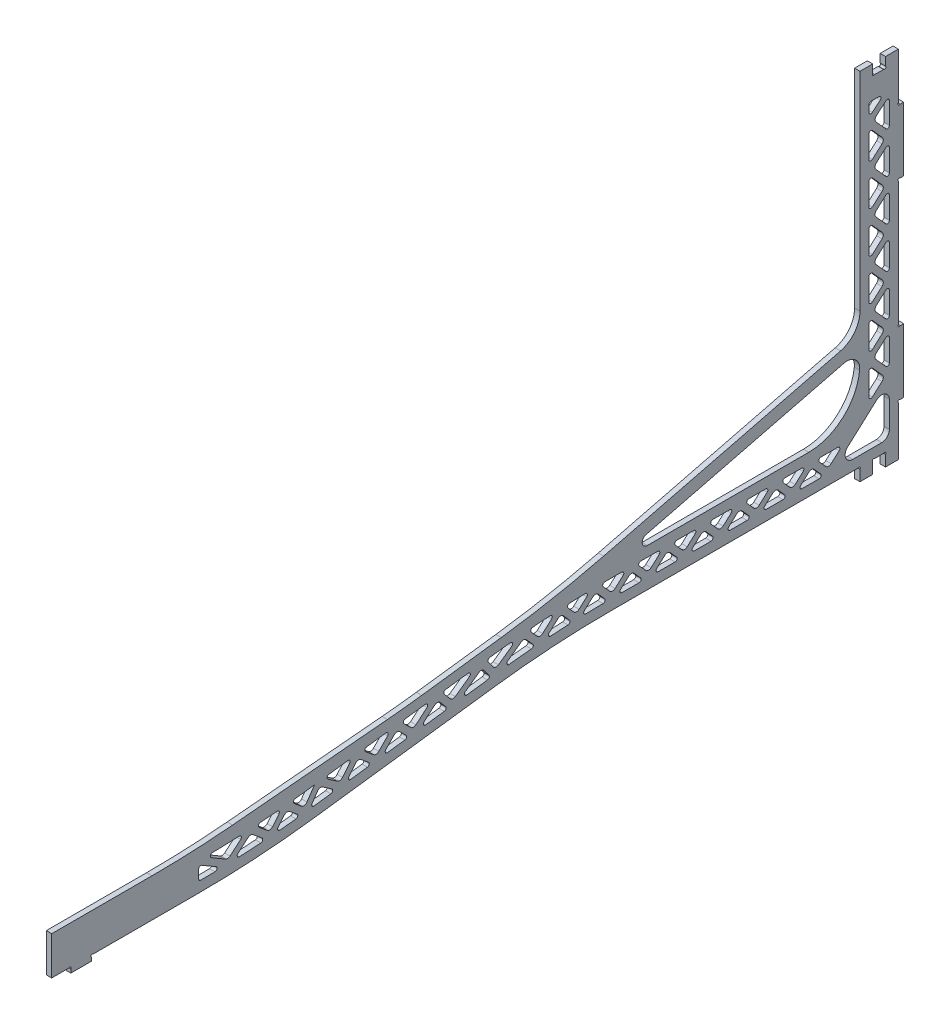
from build123d import *

# Parameters (mm, degrees)
SKETCH_2_W          = 5
SKETCH_2_H          = 4
SKETCH_2_H_2        = 5
EXTRUDE_1_DEPTH     = 1.05
SKETCH_3_W          = 2.1
SKETCH_3_H          = 25
EXTRUDE_2_DEPTH     = 2.1
FILLET_1_R          = 20
EXTRUDE_1_2_DEPTH   = 2.1
FILLET_2_R          = 10
FILLET_3_R          = 5
FILLET_4_R          = 2
FILLET_5_R          = 350
SKETCH_6_W          = 8
SKETCH_6_H          = 111.683841337
CUT_EXTRUDE_1_DEPTH = 10
CUT_EXTRUDE_2_DEPTH = 10
EXTRUDE_2_2_DEPTH   = 2.1
FILLET_6_R          = 3
FILLET_7_R          = 0.8
FILLET_8_R          = 1.5
FILLET_9_R          = 0.8
FILLET_10_R         = 1.5
CUT_EXTRUDE_3_DEPTH = 2.1
FILLET_11_R         = 0.3
SKETCH_10_W         = 8
SKETCH_10_H         = 2.1
EXTRUDE_3_DEPTH     = 2.1
SKETCH_11_R         = 0.5
CUT_EXTRUDE_4_DEPTH = 360.048771191
FILLET_12_R         = 0.3


with BuildPart() as part:
    # 草图2 → Extrude 1 (new, symmetric)
    with BuildSketch(Plane(origin=(0, 0, 0), x_dir=(0, 0, -1), z_dir=(1, 0, 0))):
        Polygon((55, 0), (0, 0), (0, -15), (80, -15), (196, 0), (80, 0), align=None)
        Polygon((138, 7.5), (80, 0), (196, 0), (316, 0), (321, 0), (326, 0), (331, 0), (331, 130), (326, 130), (321, 130), (316, 130), (316, 15), (196, 15), align=None)
        with Locations((328.5, 132)):
            Rectangle(SKETCH_2_W, SKETCH_2_H)
        with Locations((328.5, -2.5)):
            Rectangle(SKETCH_2_W, SKETCH_2_H_2)
        with Locations((318.5, -2.5)):
            Rectangle(SKETCH_2_W, SKETCH_2_H_2)
        Polygon((138, 7.5), (55, 0), (80, 0), align=None)
        with Locations((318.5, 132)):
            Rectangle(SKETCH_2_W, SKETCH_2_H)
    extrude(amount=EXTRUDE_1_DEPTH, both=True)

    # 草图3 → Extrude 2 (add)
    with BuildSketch(Plane(origin=(1.05, 0, 0), x_dir=(0, 0, -1), z_dir=(1, 0, 0))):
        with Locations((332.05, 102.5)):
            Rectangle(SKETCH_3_W, SKETCH_3_H)
        with Locations((332.05, 27.5)):
            Rectangle(SKETCH_3_W, SKETCH_3_H)
    extrude(amount=-EXTRUDE_2_DEPTH)

    # 圆角1
    fillet_1_edges = [part.edges().sort_by_distance(p)[0] for p in [
        (0, 15, -316),
    ]]
    fillet(fillet_1_edges, radius=FILLET_1_R)

    # 草图5 → Extrude 1 2 (add)
    with BuildSketch(Plane.ZY.offset(1.05)):
        Polygon((-316, 45), (-196, 15), (-197.212678125, 10.149287499), (-317.212678125, 40.149287499), align=None)
    extrude(amount=-EXTRUDE_1_2_DEPTH)

    # 圆角2
    fillet_2_edges = [part.edges().sort_by_distance(p)[0] for p in [
        (0, 45, -316),
    ]]
    fillet(fillet_2_edges, radius=FILLET_2_R)

    # 圆角3
    fillet_3_edges = [part.edges().sort_by_distance(p)[0] for p in [
        (0, 39.846117968, -316),
    ]]
    fillet(fillet_3_edges, radius=FILLET_3_R)

    # 圆角4
    fillet_4_edges = [part.edges().sort_by_distance(p)[0] for p in [
        (0, 15, -216.615528128),
    ]]
    fillet(fillet_4_edges, radius=FILLET_4_R)

    # 圆角5
    # the kernel refuses this fillet: 350 mm, written as the material it adds along each edge
    with BuildSketch(Plane(origin=(1.05, 15, -196), x_dir=(0, 0.24253562503633327, -0.9701425001453318), z_dir=(-1, 0, 0))) as fillet_5_piece_1:
        with BuildLine():
            CenterArc((FILLET_5_R * 0.0582567271498, -FILLET_5_R), FILLET_5_R, 90, 6.668192396)
            Line((-FILLET_5_R * 0.0578626358841, -FILLET_5_R * 0.00676473404908), (0, 0))
            Line((0, 0), (FILLET_5_R * 0.0582567271498, 0))
        make_face()
    extrude(amount=2.1)
    with BuildSketch(Plane(origin=(1.05, 0, -196), x_dir=(0, -0.12824260686651542, 0.9917428264343939), z_dir=(-1, 0, 0))) as fillet_5_piece_2:
        with BuildLine():
            CenterArc((FILLET_5_R * 0.0643871312925, -FILLET_5_R), FILLET_5_R, 90, 7.368051072)
            Line((-FILLET_5_R * 0.063855475574, -FILLET_5_R * 0.00825717356561), (0, 0))
            Line((0, 0), (FILLET_5_R * 0.0643871312925, 0))
        make_face()
    extrude(amount=2.1)
    with BuildSketch(Plane(origin=(1.05, 0, -55), x_dir=(0, 0.08999478045409695, -0.9959422370253301), z_dir=(-1, 0, 0))) as fillet_5_piece_3:
        with BuildLine():
            CenterArc((FILLET_5_R * 0.0450888702011, -FILLET_5_R), FILLET_5_R, 90, 5.163306814)
            Line((-FILLET_5_R * 0.044905910253, -FILLET_5_R * 0.00405776297467), (0, 0))
            Line((0, 0), (FILLET_5_R * 0.0450888702011, 0))
        make_face()
    extrude(amount=2.1)
    with BuildSketch(Plane(origin=(-1.05, 7.5, -138), x_dir=(0, 0.12824260686651465, -0.991742826434394), z_dir=(1, 0, 0))) as fillet_5_piece_4:
        with BuildLine():
            CenterArc((FILLET_5_R * 0.0192423976592, FILLET_5_R), FILLET_5_R, 267.795255743, 2.204744257)
            Line((-FILLET_5_R * 0.0192281531735, FILLET_5_R * 0.000740265637293), (0, 0))
            Line((0, 0), (FILLET_5_R * 0.0192423976592, 0))
        make_face()
    extrude(amount=2.1)
    # the kernel refuses this fillet: 350 mm, written as the material it takes off along each edge
    with BuildSketch(Plane(origin=(-57.388739881, -15, -80), x_dir=(0, 0, 1), z_dir=(1, 0, 0))) as fillet_5_2_piece_1:
        with BuildLine():
            CenterArc((FILLET_5_R * 0.0643871312925, -FILLET_5_R), FILLET_5_R, 90, 7.368051072)
            Line((-FILLET_5_R * 0.063855475574, -FILLET_5_R * 0.00825717356561), (0, 0))
            Line((0, 0), (FILLET_5_R * 0.0643871312925, 0))
        make_face()
    extrude(amount=114.777479762, mode=Mode.SUBTRACT)

    # 草图6 → 切除-拉伸1 (cut)
    with BuildSketch(Plane(origin=(1.05, 0, 0), x_dir=(0, 0, -1), z_dir=(1, 0, 0))):
        with Locations((323.5, 65.841920668)):
            Rectangle(SKETCH_6_W, SKETCH_6_H)
    extrude(amount=-CUT_EXTRUDE_1_DEPTH, mode=Mode.SUBTRACT)

    # 草图7 → 切除-拉伸2 (cut)
    with BuildSketch(Plane(origin=(1.05, 0, 0), x_dir=(0, 0, -1), z_dir=(1, 0, 0))):
        with BuildLine():
            Line((319.5, 20), (309.5, 11))
            Line((309.5, 11), (218.535495952, 11))
            ThreePointArc((218.535495952, 11), (195.339773111, 10.254019328), (172.239914874, 8.019160343))
            Line((172.239914874, 8.019160343), (100.938747775, -1.200818161))
            ThreePointArc((100.938747775, -1.200818161), (79.246637131, -3.299480754), (57.464504048, -4))
            Line((57.464504048, -4), (57.464504048, -11))
            ThreePointArc((57.464504048, -11), (79.69641569, -10.285015755), (101.836446023, -8.143017946))
            Line((101.836446023, -8.143017946), (173.137613122, 1.076960558))
            ThreePointArc((173.137613122, 1.076960558), (195.789551671, 3.268484327), (218.535495952, 4))
            Line((218.535495952, 4), (316, 4))
            Line((316, 4), (327.5, 4))
            Line((327.5, 4), (327.5, 10))
            Line((327.5, 10), (319.5, 10))
            Line((319.5, 10), (319.5, 20))
        make_face()
    extrude(amount=-CUT_EXTRUDE_2_DEPTH, mode=Mode.SUBTRACT)

    # 草图8 → Extrude 2 2 (add)
    with BuildSketch(Plane(origin=(1.05, 0, 0), x_dir=(0, 0, -1), z_dir=(1, 0, 0))):
        Polygon((56.830971449, -5.077560414), (69.174998853, -12.335013141), (77.745359711, -5.025292737), (85.730650552, -11.616970915), (91.892771273, -4.152054572), (99.373304454, -10.327066643), (104.770718871, -2.485193231), (113.317583217, -8.367839688), (119.773707919, -0.546761041), (127.085564604, -6.582534453), (134.970440798, 1.430282507), (141.235611396, -4.73485202), (150.910479815, 3.516910567), (156.264670666, -2.760668488), (168.253906877, 5.778892821), (172.844663523, -0.666364005), (184.675950313, 7.760694828), (190.633924069, 1.140723988), (199.047910617, 8.713311882), (204.878682549, 2.234676403), (212.656460327, 9.234676403), (218.956460327, 2.234676403), (226.734238105, 9.234676403), (233.034238105, 2.234676403), (240.812015882, 9.234676403), (247.112015882, 2.234676403), (254.88979366, 9.234676403), (261.18979366, 2.234676403), (268.967571438, 9.234676403), (275.267571438, 2.234676403), (283.045349216, 9.234676403), (289.345349216, 2.234676403), (297.123126994, 9.234676403), (303.423126994, 2.234676403), (329.265323597, 25.492653346), (321.265323597, 34.381542235), (329.265323597, 41.581542235), (321.265323597, 50.470431124), (329.265323597, 57.670431124), (321.265323597, 66.559320013), (329.265323597, 73.759320013), (321.265323597, 82.648208902), (329.265323597, 89.848208902), (321.265323597, 98.737097791), (329.265323597, 105.937097791), (321.291544589, 114.796852244), (328.307129629, 120.729356261), (326.692870371, 122.638326414), (317.708455411, 115.040944651), (325.734676403, 106.122921327), (317.734676403, 98.922921327), (325.734676403, 90.034032438), (317.734676403, 82.834032438), (325.734676403, 73.945143549), (317.734676403, 66.745143549), (325.734676403, 57.85625466), (317.734676403, 50.65625466), (325.734676403, 41.767365772), (317.734676403, 34.567365772), (325.734676403, 25.678476883), (303.60895053, 5.765323597), (297.30895053, 12.765323597), (289.531172752, 5.765323597), (283.231172752, 12.765323597), (275.453394975, 5.765323597), (269.153394975, 12.765323597), (261.375617197, 5.765323597), (255.075617197, 12.765323597), (247.297839419, 5.765323597), (240.997839419, 12.765323597), (233.220061641, 5.765323597), (226.920061641, 12.765323597), (219.142283863, 5.765323597), (212.842283863, 12.765323597), (205.064506086, 5.765323597), (199.233734154, 12.243959077), (190.819747605, 4.671371183), (185.042185799, 11.090884302), (173.43056272, 2.820285121), (168.839806074, 9.265541947), (156.680197195, 0.604629468), (151.190267994, 7.04135642), (141.356251678, -1.346144516), (134.941988602, 4.965701927), (126.910400493, -3.196207511), (119.437231888, 2.972725268), (112.847947819, -5.0096653), (104.128779789, 0.991574552), (98.860787351, -6.662262385), (91.556295241, -0.632568263), (85.39417452, -8.097484606), (77.719096561, -1.761880192), (68.9072777, -9.277541806), (58.098036647, -2.922439586), align=None)
    extrude(amount=-EXTRUDE_2_2_DEPTH)

    # 圆角6
    fillet_6_edges = [part.edges().sort_by_distance(p)[0] for p in [
        (0, 4, -327.5),
        (0, 4, -305.384597657),
        (0, 23.903862108, -327.5),
    ]]
    fillet(fillet_6_edges, radius=FILLET_6_R)

    # 圆角7
    fillet_7_edges = [part.edges().sort_by_distance(p)[0] for p in [
        (0, 121.683841337, -319.5),
        (0, 121.683841337, -325.564127566),
        (0, 120.04683303, -327.5),
        (0, 107.898568454, -327.5),
        (0, 104.348306553, -327.5),
        (0, 91.809679565, -327.5),
        (0, 88.259417664, -327.5),
        (0, 75.720790676, -327.5),
        (0, 72.170528775, -327.5),
        (0, 59.631901788, -327.5),
        (0, 56.081639886, -327.5),
        (0, 43.543012899, -327.5),
        (0, 39.992750997, -327.5),
        (0, 27.45412401, -327.5),
        (0, 32.605895108, -319.5),
        (0, 36.156157009, -319.5),
        (0, 48.694783997, -319.5),
        (0, 52.245045898, -319.5),
        (0, 64.783672886, -319.5),
        (0, 68.333934787, -319.5),
        (0, 80.872561774, -319.5),
        (0, 84.422823676, -319.5),
        (0, 96.961450663, -319.5),
        (0, 100.511712565, -319.5),
        (0, 113.050339552, -319.5),
        (0, 116.555906755, -319.5),
        (0, 20.06726812, -319.5),
    ]]
    fillet(fillet_7_edges, radius=FILLET_7_R)

    # 圆角8
    fillet_8_edges = [part.edges().sort_by_distance(p)[0] for p in [
        (0, 106.122921327, -325.734676403),
        (0, 90.034032438, -325.734676403),
        (0, 73.945143549, -325.734676403),
        (0, 57.85625466, -325.734676403),
        (0, 41.767365772, -325.734676403),
        (0, 25.678476883, -325.734676403),
        (0, 34.381542235, -321.265323597),
        (0, 50.470431124, -321.265323597),
        (0, 66.559320013, -321.265323597),
        (0, 82.648208902, -321.265323597),
        (0, 98.737097791, -321.265323597),
        (0, 114.796852244, -321.291544589),
    ]]
    fillet(fillet_8_edges, radius=FILLET_8_R)

    # 圆角9
    fillet_9_edges = [part.edges().sort_by_distance(p)[0] for p in [
        (0, 4, -263.151264324),
        (0, 4, -277.229042102),
        (0, 4, -291.306819879),
        (0, 4, -249.073486546),
        (0, 4, -234.995708768),
        (0, 4, -220.917930991),
        (0, 3.799312371, -206.617166958),
        (0, 1.405284076, -175.753182742),
        (0, 3.060913643, -192.767468129),
        (0, -0.737604043, -159.104980213),
        (0, -2.746902673, -143.56640414),
        (0, -4.629535048, -129.007380439),
        (0, -6.454111457, -114.897322875),
        (0, -9.71089339, -87.304074723),
        (0, -10.733056747, -71.053229977),
        (0, -10.876857545, -66.694856948),
        (0, -9.998573964, -83.770092102),
        (0, -6.928755117, -111.22674524),
        (0, -5.108890736, -125.300363118),
        (0, -3.244184711, -139.720756375),
        (0, -1.269361265, -154.99272436),
        (0, 0.895248753, -171.732375163),
        (0, 2.77903506, -189.159444104),
        (0, 3.683714693, -203.574548088),
        (0, 4, -231.445446867),
        (0, 4, -245.523224645),
        (0, 4, -259.601002423),
        (0, 4, -273.6787802),
        (0, 4, -287.756557978),
        (0, 4, -301.834335756),
        (0, 11, -284.81996399),
        (0, 11, -298.897741768),
        (0, 11, -270.742186212),
        (0, 11, -256.664408434),
        (0, 11, -242.586630657),
        (0, 11, -228.508852879),
        (0, 10.976902229, -214.451863095),
        (0, 10.561510398, -200.747937965),
        (0, 9.567980183, -186.412799505),
        (0, 7.721686022, -169.939446792),
        (0, 5.470475248, -152.530083475),
        (0, 3.40167866, -136.531389862),
        (0, 1.432501868, -121.303089334),
        (0, -0.506806717, -106.305769608),
        (0, -2.097334528, -93.330742404),
        (0, -3.279330496, -79.557366223),
        (0, -3.991137564, -59.915759424),
        (0, -3.510880012, -75.668462778),
        (0, -2.427922885, -90.074270339),
        (0, 0.978341076, -117.790912546),
        (0, 2.938156283, -132.94681681),
        (0, 4.985537898, -148.779901302),
        (0, 7.20549577, -165.947575509),
        (0, 9.183268111, -182.363961441),
        (0, 10.365826377, -197.146920043),
        (0, 10.916864571, -210.788440501),
        (0, 11, -224.958590978),
        (0, 11, -239.036368755),
        (0, 11, -253.114146533),
        (0, 11, -267.191924311),
        (0, 11, -281.269702089),
        (0, 11, -295.347479866),
        (0, 11, -309.425257644),
        (0, 3.998079394, -217.369397635),
        (0, -8.68888837, -97.388782515),
        (0, -8.27746931, -100.784003864),
        (0, -11, -57.464504048),
        (0, -5.450034708, -57.464504048),
    ]]
    fillet(fillet_9_edges, radius=FILLET_9_R)

    # 圆角10
    fillet_10_edges = [part.edges().sort_by_distance(p)[0] for p in [
        (0, -5.025292737, -77.745359711),
        (0, -4.152054572, -91.892771273),
        (0, -2.485193231, -104.770718871),
        (0, 0.604629468, -156.680197195),
        (0, -1.346144516, -141.356251678),
        (0, -3.196207511, -126.910400493),
        (0, -5.0096653, -112.847947819),
        (0, -6.662262385, -98.860787351),
        (0, 5.765323597, -205.064506086),
        (0, 4.671371183, -190.819747605),
        (0, 2.820285121, -173.43056272),
        (0, 5.765323597, -303.60895053),
        (0, 5.765323597, -289.531172752),
        (0, 5.765323597, -275.453394975),
        (0, 5.765323597, -261.375617197),
        (0, 5.765323597, -247.297839419),
        (0, 5.765323597, -233.220061641),
        (0, 5.765323597, -219.142283863),
        (0, -0.546761041, -119.773707919),
        (0, 1.430282507, -134.970440798),
        (0, 3.516910567, -150.910479815),
        (0, 5.778892821, -168.253906877),
        (0, 7.760694828, -184.675950313),
        (0, 8.713311882, -199.047910617),
        (0, 9.234676403, -212.656460327),
        (0, 9.234676403, -226.734238105),
        (0, 9.234676403, -240.812015882),
        (0, 9.234676403, -254.88979366),
        (0, 9.234676403, -268.967571438),
        (0, 9.234676403, -283.045349216),
        (0, 9.234676403, -297.123126994),
        (0, -8.097484606, -85.39417452),
        (0, -9.277541806, -68.9072777),
    ]]
    fillet(fillet_10_edges, radius=FILLET_10_R)

    # 草图9 → 切除-拉伸3 (cut)
    with BuildSketch(Plane(origin=(1.05, 0, 0), x_dir=(0, 0, -1), z_dir=(1, 0, 0))):
        with BuildLine():
            ThreePointArc((326.146446609, 130.353553391), (326.108386376, 130.544895107), (326, 130.707106781))
            Line((326, 130.707106781), (325.646446609, 130.353553391))
            Line((325.646446609, 130.353553391), (326, 130))
            ThreePointArc((326, 130), (326.108386376, 130.162211674), (326.146446609, 130.353553391))
        make_face()
        with BuildLine():
            Line((326, 130), (325.646446609, 130.353553391))
            Line((325.646446609, 130.353553391), (325.292893219, 130))
            ThreePointArc((325.292893219, 130), (325.646446609, 129.853553391), (326, 130))
        make_face()
        with BuildLine():
            Line((331.353553391, 115.353553391), (331, 115.707106781))
            ThreePointArc((331, 115.707106781), (330.853553391, 115.353553391), (331, 115))
            Line((331, 115), (331.353553391, 115.353553391))
        make_face()
        with BuildLine():
            Line((331.707106781, 115), (331.353553391, 115.353553391))
            Line((331.353553391, 115.353553391), (331, 115))
            ThreePointArc((331, 115), (331.353553391, 114.853553391), (331.707106781, 115))
        make_face()
        with BuildLine():
            Line((331.353553391, 89.646446609), (331.707106781, 90))
            ThreePointArc((331.707106781, 90), (331.353553391, 90.146446609), (331, 90))
            Line((331, 90), (331.353553391, 89.646446609))
        make_face()
        with BuildLine():
            Line((331, 89.292893219), (331.353553391, 89.646446609))
            Line((331.353553391, 89.646446609), (331, 90))
            ThreePointArc((331, 90), (330.853553391, 89.646446609), (331, 89.292893219))
        make_face()
        with BuildLine():
            ThreePointArc((331, 40), (331.353553391, 39.853553391), (331.707106781, 40))
            Line((331.707106781, 40), (331.353553391, 40.353553391))
            Line((331.353553391, 40.353553391), (331, 40))
        make_face()
        with BuildLine():
            Line((331, 40), (331.353553391, 40.353553391))
            Line((331.353553391, 40.353553391), (331, 40.707106781))
            ThreePointArc((331, 40.707106781), (330.853553391, 40.353553391), (331, 40))
        make_face()
        with BuildLine():
            Line((331.353553391, 14.646446609), (331.707106781, 15))
            ThreePointArc((331.707106781, 15), (331.353553391, 15.146446609), (331, 15))
            Line((331, 15), (331.353553391, 14.646446609))
        make_face()
        with BuildLine():
            Line((331, 14.292893219), (331.353553391, 14.646446609))
            Line((331.353553391, 14.646446609), (331, 15))
            ThreePointArc((331, 15), (330.853553391, 14.646446609), (331, 14.292893219))
        make_face()
        with BuildLine():
            Line((325.646446609, -0.353553391), (326, -0.707106781))
            ThreePointArc((326, -0.707106781), (326.108386376, -0.544895107), (326.146446609, -0.353553391))
            ThreePointArc((326.146446609, -0.353553391), (326.108386376, -0.162211674), (326, 0))
            Line((326, 0), (325.646446609, -0.353553391))
        make_face()
        with BuildLine():
            Line((325.292893219, 0), (325.646446609, -0.353553391))
            Line((325.646446609, -0.353553391), (326, 0))
            ThreePointArc((326, 0), (325.646446609, 0.146446609), (325.292893219, 0))
        make_face()
        with BuildLine():
            Line((321.353553391, -0.353553391), (321.707106781, 0))
            ThreePointArc((321.707106781, 0), (321.353553391, 0.146446609), (321, 0))
            Line((321, 0), (321.353553391, -0.353553391))
        make_face()
        with BuildLine():
            Line((321, -0.707106781), (321.353553391, -0.353553391))
            Line((321.353553391, -0.353553391), (321, 0))
            ThreePointArc((321, 0), (320.853553391, -0.353553391), (321, -0.707106781))
        make_face()
        with BuildLine():
            Line((315.646446609, -0.353553391), (316, -0.707106781))
            ThreePointArc((316, -0.707106781), (316.108386376, -0.544895107), (316.146446609, -0.353553391))
            ThreePointArc((316.146446609, -0.353553391), (316.108386376, -0.162211674), (316, 0))
            Line((316, 0), (315.646446609, -0.353553391))
        make_face()
        with BuildLine():
            Line((315.292893219, 0), (315.646446609, -0.353553391))
            Line((315.646446609, -0.353553391), (316, 0))
            ThreePointArc((316, 0), (315.646446609, 0.146446609), (315.292893219, 0))
        make_face()
        with BuildLine():
            ThreePointArc((321, 130), (321.353553391, 129.853553391), (321.707106781, 130))
            Line((321.707106781, 130), (321.353553391, 130.353553391))
            Line((321.353553391, 130.353553391), (321, 130))
        make_face()
        with BuildLine():
            Line((321, 130), (321.353553391, 130.353553391))
            Line((321.353553391, 130.353553391), (321, 130.707106781))
            ThreePointArc((321, 130.707106781), (320.853553391, 130.353553391), (321, 130))
        make_face()
    extrude(amount=-CUT_EXTRUDE_3_DEPTH, mode=Mode.SUBTRACT)

    # 圆角11
    fillet_11_edges = [part.edges().sort_by_distance(p)[0] for p in [
        (0, 0, -325.292893219),
        (0, -0.707106781, -326),
        (0, 0, -321.707106781),
        (0, -0.707106781, -321),
        (0, 0, -315.292893219),
        (0, -0.707106781, -316),
        (0, 130, -321.707106781),
        (0, 130.707106781, -321),
        (0, 15, -331.707106781),
        (0, 14.292893219, -331),
        (0, 40, -331.707106781),
        (0, 40.707106781, -331),
        (0, 90, -331.707106781),
        (0, 89.292893219, -331),
        (0, 115, -331.707106781),
        (0, 115.707106781, -331),
        (0, 130, -325.292893219),
        (0, 130.707106781, -326),
    ]]
    fillet(fillet_11_edges, radius=FILLET_11_R)

    # 草图10 → 凸台-拉伸3 (add)
    with BuildSketch(Plane(origin=(1.05, 0, 0), x_dir=(0, 0, -1), z_dir=(1, 0, 0))):
        with Locations((11.5, -16.05)):
            Rectangle(SKETCH_10_W, SKETCH_10_H)
    extrude(amount=-EXTRUDE_3_DEPTH)

    # 草图11 → 切除-拉伸4 (cut, through all)
    with BuildSketch(Plane(origin=(1.05, 0, 0), x_dir=(0, 0, -1), z_dir=(1, 0, 0))):
        with Locations((15.853553391, -15.353553391)):
            Circle(SKETCH_11_R)
        with Locations((7.146446609, -15.353553391)):
            Circle(SKETCH_11_R)
    extrude(amount=-CUT_EXTRUDE_4_DEPTH, mode=Mode.SUBTRACT)

    # 圆角12
    fillet_12_edges = [part.edges().sort_by_distance(p)[0] for p in [
        (0, -15.707106781, -7.5),
        (0, -15.707106781, -15.5),
        (0, -15, -16.207106781),
        (0, -15, -6.792893219),
    ]]
    fillet(fillet_12_edges, radius=FILLET_12_R)


solid = part.part
